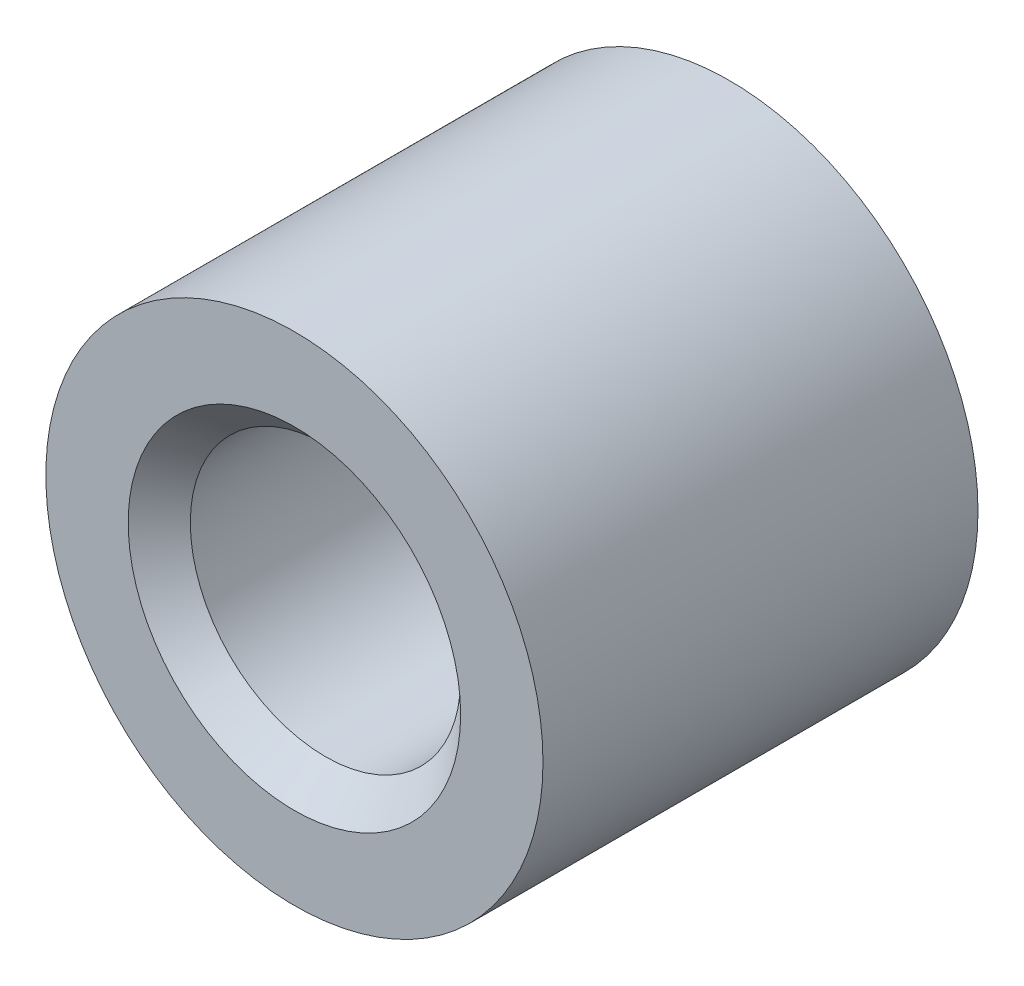
from build123d import *

# Parameters (mm, degrees)
SKETCH1_R           = 8
SKETCH1_R_2         = 4.35
BOSS_EXTRUDE1_DEPTH = 14
CHAMFER1_SIZE       = 1


with BuildPart() as part:
    # Sketch1 → Boss-Extrude1 (new body)
    with BuildSketch(Plane.XY):
        Circle(SKETCH1_R)
        Circle(SKETCH1_R_2, mode=Mode.SUBTRACT)
    extrude(amount=BOSS_EXTRUDE1_DEPTH)

    # Chamfer1
    chamfer1_edges = [part.edges().sort_by_distance(p)[0] for p in [
        (-4.35, 0, 14),
        (-4.35, 0, 0),
    ]]
    chamfer(chamfer1_edges, length=CHAMFER1_SIZE)


solid = part.part
